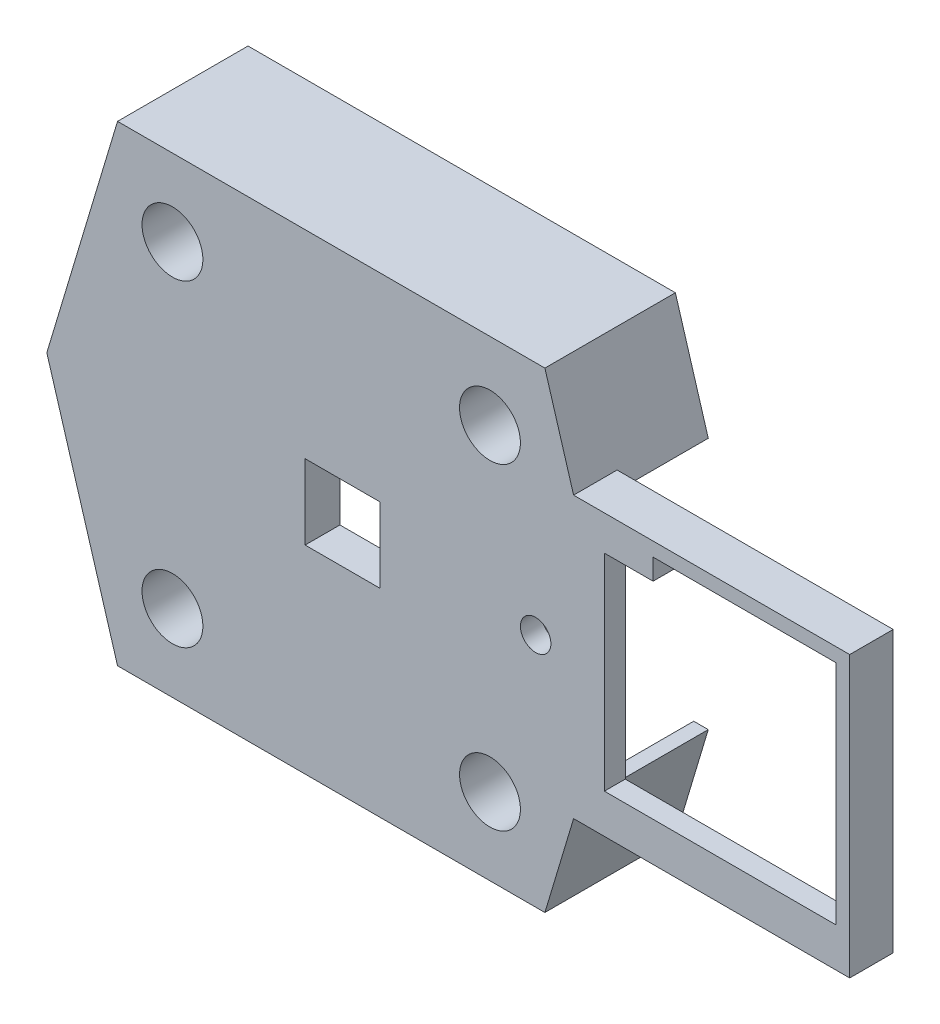
from build123d import *
from build123d.topology import SkipClean

# Parameters (mm, degrees)
BOSS_EXTRUDE1_DEPTH      = 10
BOSS_EXTRUDE1_DEPTH_BACK = 5
BOSS_EXTRUDE2_DEPTH      = 5
CUT_EXTRUDE1_DEPTH       = 68.168221653
BOSS_EXTRUDE3_DEPTH      = 4
SKETCH7_R                = 1.75
BOSS_EXTRUDE4_DEPTH      = 2.4
SKETCH8_R                = 3.5
BOSS_EXTRUDE5_DEPTH      = 1
SKETCH9_R                = 5.1
SKETCH9_R_2              = 3.5
BOSS_EXTRUDE6_DEPTH      = 9


with BuildPart() as part:
    # Sketch2 → Boss-Extrude1 (new, two sides: drawn at the far end of the back side and taken through both)
    with BuildSketch(Plane.XY.offset(12).offset(-BOSS_EXTRUDE1_DEPTH_BACK)):
        Polygon((-24.562464367, 27.1), (-32.692464367, 0), (-24.562464367, -27.1), (24.562464367, -27.1), (32.692464367, 0), (24.562464367, 27.1), align=None)
        Polygon((-23.372015325, 25.5), (-31.022015325, 0), (-23.372015325, -25.5), (23.372015325, -25.5), (31.022015325, 0), (23.372015325, 25.5), align=None, mode=Mode.SUBTRACT)
    extrude(amount=BOSS_EXTRUDE1_DEPTH + BOSS_EXTRUDE1_DEPTH_BACK)

    # Sketch3 → Boss-Extrude2 (add)
    with BuildSketch(Plane.XY.offset(22)):
        Polygon((29.5, 16.1), (59.6, 16.1), (59.6, -16.1), (29.5, -16.1), (27.862464367, -16.1), (28.342464367, -14.5), (29.5, -14.5), (58, -14.5), (58, 14.5), (29.5, 14.5), (28.342464367, 14.5), (27.862464367, 16.1), align=None)
    extrude(amount=-BOSS_EXTRUDE2_DEPTH)

    # Sketch4 → Cut-Extrude1 (cut, through all)
    with BuildSketch(Plane(origin=(0, 0, 7), x_dir=(-1, 0, 0), z_dir=(0, 0, -1))):
        Polygon((-26.672015325, 14.5), (-28.342464367, 14.5), (-32.692464367, 0), (-28.342464367, -14.5), (-26.672015325, -14.5), (-31.022015325, 0), align=None)
    extrude(amount=-CUT_EXTRUDE1_DEPTH, mode=Mode.SUBTRACT)

    # Sketch5 → Boss-Extrude3 (add)
    with BuildSketch(Plane.XY.offset(22)):
        Polygon((29, 4.3), (29, 14), (29, 14.5), (27.4, 14.5), (27.4, 14), (27.4, 5.9), (-4.6, 5.9), (-4.6, -5.9), (27.4, -5.9), (27.4, -14), (27.4, -14.5), (29, -14.5), (29, -14), (29, -4.3), (-3, -4.3), (-3, 4.3), align=None)
    extrude(amount=-BOSS_EXTRUDE3_DEPTH)

    # Sketch7 → Boss-Extrude4 (add)
    with BuildSketch(Plane.XY.offset(22)):
        Polygon((37, 12.1), (37, 14.5), (29, 14.5), (29, 4.3), (5.6, 4.3), (5.6, -4.3), (29, -4.3), (29, -14.5), (58, -14.5), (58, -11.6), (31.4, -11.6), (31.4, 12.1), align=None)
        with Locations((23.5, 0)):
            Circle(SKETCH7_R, mode=Mode.SUBTRACT)
    extrude(amount=-BOSS_EXTRUDE4_DEPTH)

    # Sketch8 → Boss-Extrude5 (add)
    with BuildSketch(Plane.XY.offset(22)):
        Polygon((27.4, -14.5), (27.4, -5.9), (-4.6, -5.9), (-4.6, 5.9), (27.4, 5.9), (27.4, 14.5), (26.672015325, 14.5), (23.372015325, 25.5), (-23.372015325, 25.5), (-31.022015325, 0), (-23.372015325, -25.5), (23.372015325, -25.5), (26.672015325, -14.5), align=None)
        with Locations((-18.25, -18.25)):
            Circle(SKETCH8_R, mode=Mode.SUBTRACT)
        with Locations((18.25, -18.25)):
            Circle(SKETCH8_R, mode=Mode.SUBTRACT)
        with Locations((-18.25, 18.25)):
            Circle(SKETCH8_R, mode=Mode.SUBTRACT)
        with Locations((18.25, 18.25)):
            Circle(SKETCH8_R, mode=Mode.SUBTRACT)
    extrude(amount=-BOSS_EXTRUDE5_DEPTH)

    # Sketch9 → Boss-Extrude6 (add)
    # profile 1 of 4: a face of its own
    with SkipClean():  # the faces are left unmerged after this step: merging them gives an invalid solid
        with BuildSketch(Plane(origin=(0, 0, 21), x_dir=(-1, 0, 0), z_dir=(0, 0, -1))):
            with Locations((-18.25, 18.25)):
                Circle(SKETCH9_R)
            with Locations((-18.25, 18.25)):
                Circle(SKETCH9_R_2, mode=Mode.SUBTRACT)
        # profile 2 of 4: a face of its own
        with BuildSketch(Plane(origin=(0, 0, 21), x_dir=(-1, 0, 0), z_dir=(0, 0, -1))):
            with Locations((18.25, 18.25)):
                Circle(SKETCH9_R)
            with Locations((18.25, 18.25)):
                Circle(SKETCH9_R_2, mode=Mode.SUBTRACT)
        # profile 3 of 4: a face of its own
        with BuildSketch(Plane(origin=(0, 0, 21), x_dir=(-1, 0, 0), z_dir=(0, 0, -1))):
            with Locations((18.25, -18.25)):
                Circle(SKETCH9_R)
            with Locations((18.25, -18.25)):
                Circle(SKETCH9_R_2, mode=Mode.SUBTRACT)
        # profile 4 of 4: a face of its own
        with BuildSketch(Plane(origin=(0, 0, 21), x_dir=(-1, 0, 0), z_dir=(0, 0, -1))):
            with Locations((-18.25, -18.25)):
                Circle(SKETCH9_R)
            with Locations((-18.25, -18.25)):
                Circle(SKETCH9_R_2, mode=Mode.SUBTRACT)
        extrude(amount=BOSS_EXTRUDE6_DEPTH)
    add(part.part.scale(1), mode=Mode.REPLACE)  # the faces are merged on a copy


solid = part.part
